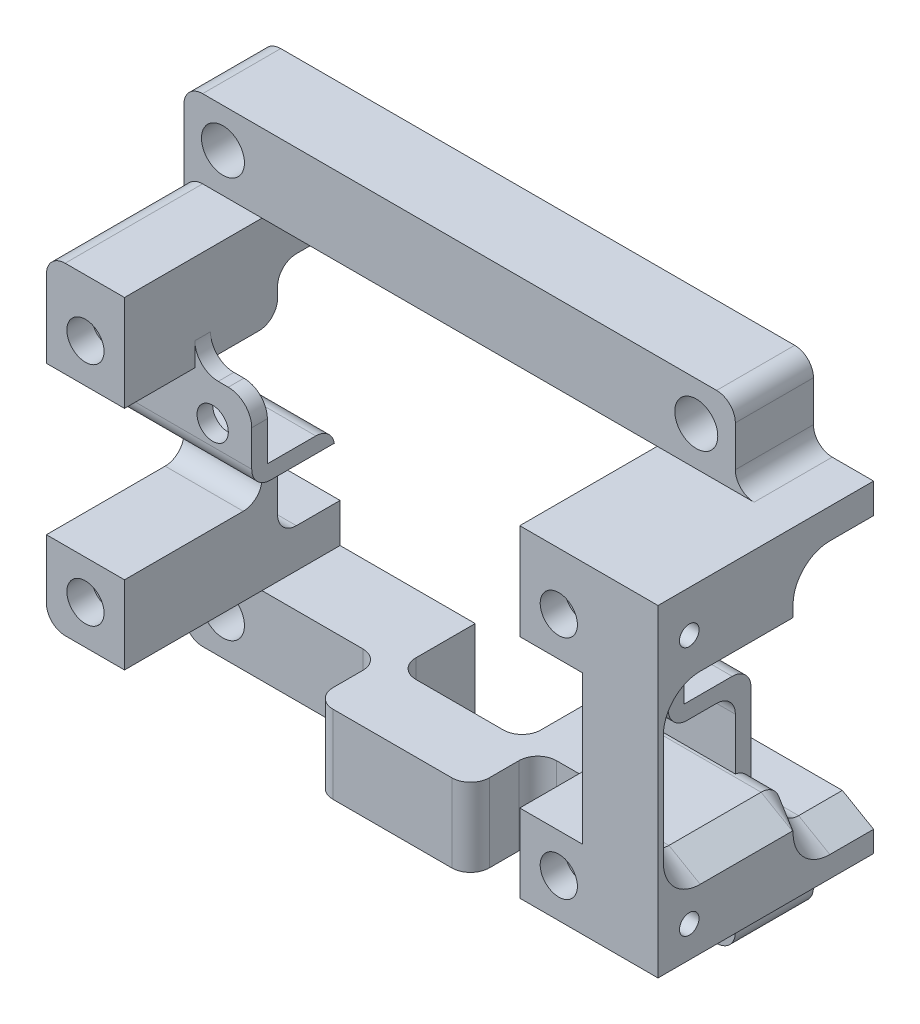
from build123d import *
from OCP.BRepFilletAPI import BRepFilletAPI_MakeChamfer

# Parameters (mm, degrees)
SKETCH1_W                       = 70.6
SKETCH1_H                       = 61.3
BOSS_EXTRUDE1_DEPTH             = 10
SKETCH2_W                       = 17.2875
SKETCH2_H                       = 10
BOSS_EXTRUDE2_DEPTH             = 8.6
M3_CLEARANCE_HOLE1_D            = 4
M3_CLEARANCE_HOLE1_DEPTH        = 10
M3_CLEARANCE_HOLE1_TIP          = 1.201721238
M5_CLEARANCE_HOLE1_D            = 5.5
M5_CLEARANCE_HOLE1_DEPTH        = 10
M5_CLEARANCE_HOLE1_TIP          = 1.652366702
SKETCH11_W                      = 20
SKETCH11_H                      = 10
BOSS_EXTRUDE3_DEPTH             = 8.6
CUT_EXTRUDE1_REACH              = 92.24
SKETCH15_W                      = 16
SKETCH15_H                      = 10
SKETCH16_W                      = 10
SKETCH16_H                      = 10
SKETCH16_H_2                    = 12.3
BOSS_EXTRUDE4_DEPTH             = 17.6
SKETCH17_R                      = 2.38125
CUT_EXTRUDE2_DEPTH              = 3.175
SKETCH18_W                      = 27.6
SKETCH18_H                      = 10
SKETCH18_H_2                    = 12.3
BOSS_EXTRUDE5_DEPTH             = 7.7
SKETCH19_W                      = 8.6
SKETCH19_H                      = 8
CUT_EXTRUDE3_DEPTH              = 98.524011489
SKETCH20_W                      = 9.675069895
SKETCH20_H                      = 19
BOSS_EXTRUDE6_DEPTH             = 3
FILLET4_START                   = -63.558014619
FILLET4_DEPTH                   = 10
FILLET4_START_2                 = 5.066915486
FILLET4_2_DEPTH                 = 9.675069895
FILLET4_START_3                 = -2.958014619
FILLET4_3_DEPTH                 = 10
FILLET4_START_4                 = -10.130841154
FILLET4_4_DEPTH                 = 10
FILLET4_5_DEPTH                 = 79.558014619
FILLET4_START_5                 = 7.041985381
FILLET4_6_DEPTH                 = 8.958014619
FILLET4_START_6                 = -7.815230369
FILLET4_7_DEPTH                 = 14.85721575
FILLET4_START_7                 = -11
FILLET4_8_DEPTH                 = 10.869158846
FILLET5_R                       = 2.4
TAP_DRILL_FOR_M3X0_5_TAP1_D     = 2.5
TAP_DRILL_FOR_M3X0_5_TAP1_DEPTH = 8
TAP_DRILL_FOR_M3X0_5_TAP1_TIP   = 0.751075774
CHAMFER1_SIZE                   = 4
CHAMFER1_SIZE2                  = 2.309401077
FILLET7_R                       = 3


with BuildPart() as part:
    # Sketch1 → Boss-Extrude1 (new body)
    with BuildSketch(Plane.XY):
        with Locations((-28.258014619, 20.519158846)):
            Rectangle(SKETCH1_W, SKETCH1_H)
        Polygon((-2.958014619, -0.130841154), (-53.558014619, -0.130841154), (-53.558014619, 18.869158846), (-46.270514619, 18.869158846), (-46.270514619, 28.869158846), (-53.558014619, 28.869158846), (-53.558014619, 41.169158846), (-2.958014619, 41.169158846), (-2.958014619, 28.869158846), (-10.245514619, 28.869158846), (-10.245514619, 18.869158846), (-2.958014619, 18.869158846), align=None, mode=Mode.SUBTRACT)
    extrude(amount=BOSS_EXTRUDE1_DEPTH)

    # Sketch2 → Boss-Extrude2 (add)
    with BuildSketch(Plane.XY.offset(10)):
        with Locations((-54.914264619, 23.869158846)):
            Rectangle(SKETCH2_W, SKETCH2_H)
        with Locations((-1.601764619, 23.869158846)):
            Rectangle(SKETCH2_W, SKETCH2_H)
    extrude(amount=BOSS_EXTRUDE2_DEPTH)

    # M3 Clearance Hole1
    with Locations(Plane.XY.offset(18.6)):
        with Locations((-51.270514619, 23.869158846), (-5.245514619, 23.869158846)):
            Hole(M3_CLEARANCE_HOLE1_D / 2, depth=M3_CLEARANCE_HOLE1_DEPTH)
            with Locations((0, 0, -(M3_CLEARANCE_HOLE1_DEPTH + M3_CLEARANCE_HOLE1_TIP / 2))):  # 118° drill point
                Cone(0, M3_CLEARANCE_HOLE1_D / 2, M3_CLEARANCE_HOLE1_TIP, mode=Mode.SUBTRACT)

    # M5 Clearance Hole1
    with Locations(Plane.XY.offset(10)):
        with Locations((-58.558014619, -5.130841154), (2.041985381, -5.130841154), (-58.558014619, 46.169158846), (2.041985381, 46.169158846)):
            Hole(M5_CLEARANCE_HOLE1_D / 2, depth=M5_CLEARANCE_HOLE1_DEPTH)
            with Locations((0, 0, -(M5_CLEARANCE_HOLE1_DEPTH + M5_CLEARANCE_HOLE1_TIP / 2))):  # 118° drill point
                Cone(0, M5_CLEARANCE_HOLE1_D / 2, M5_CLEARANCE_HOLE1_TIP, mode=Mode.SUBTRACT)

    # Sketch11 → Boss-Extrude3 (add)
    with BuildSketch(Plane.XY.offset(10)):
        with Locations((-28.258014619, -5.130841154)):
            Rectangle(SKETCH11_W, SKETCH11_H)
    extrude(amount=BOSS_EXTRUDE3_DEPTH)

    # Sketch15 → Cut-Extrude1 (cut, up to next)
    with BuildSketch(Plane.XZ.offset(10.130841154), mode=Mode.PRIVATE) as cut_extrude1_sk1:
        with Locations((-28.258014619, 5)):
            Rectangle(SKETCH15_W, SKETCH15_H)
    cut_extrude1_tool1 = extrude(cut_extrude1_sk1.sketch, amount=-CUT_EXTRUDE1_REACH, mode=Mode.PRIVATE) & part.part
    add(cut_extrude1_tool1.solids().sort_by_distance((-28.258015, -10.130841, 5))[0], mode=Mode.SUBTRACT)

    # Sketch16 → Boss-Extrude4 (add)
    with BuildSketch(Plane.XY.offset(10)):
        with Locations((2.041985381, 4.869158846)):
            Rectangle(SKETCH16_W, SKETCH16_H)
        with Locations((2.041985381, 35.019158846)):
            Rectangle(SKETCH16_W, SKETCH16_H_2)
        with Locations((-58.558014619, 35.019158846)):
            Rectangle(SKETCH16_W, SKETCH16_H_2)
        with Locations((-58.558014619, 4.869158846)):
            Rectangle(SKETCH16_W, SKETCH16_H)
    extrude(amount=BOSS_EXTRUDE4_DEPTH)

    # Sketch17 → Cut-Extrude2 (cut)
    with BuildSketch(Plane.XY.offset(27.6)):
        with Locations((-58.558014619, 4.869158846)):
            Circle(SKETCH17_R)
        with Locations((2.041985381, 33.869158846)):
            Circle(SKETCH17_R)
        with Locations((2.041985381, 4.869158846)):
            Circle(SKETCH17_R)
        with Locations((-58.558014619, 33.869158846)):
            Circle(SKETCH17_R)
    extrude(amount=-CUT_EXTRUDE2_DEPTH, mode=Mode.SUBTRACT)

    # Sketch18 → Boss-Extrude5 (add)
    with BuildSketch(Plane(origin=(7.041985381, 0, 0), x_dir=(0, 0, -1), z_dir=(1, 0, 0))):
        with Locations((-13.8, 4.869158846)):
            Rectangle(SKETCH18_W, SKETCH18_H)
        with Locations((-13.8, 35.019158846)):
            Rectangle(SKETCH18_W, SKETCH18_H_2)
    extrude(amount=BOSS_EXTRUDE5_DEPTH)

    # Sketch19 → Cut-Extrude3 (cut, through all)
    with BuildSketch(Plane(origin=(14.741985381, 0, 0), x_dir=(0, 0, -1), z_dir=(1, 0, 0))):
        Polygon((-8, 4.869158846), (0, 4.869158846), (0, 28.869158846), (-8, 28.869158846), (-8, 20.869158846), align=None)
        Polygon((-8, 28.869158846), (0, 28.869158846), (0, 35.019158846), (-8, 35.019158846), (-8, 30.971185105), align=None)
        with Locations((-12.3, 24.869158846)):
            Rectangle(SKETCH19_W, SKETCH19_H)
    extrude(amount=-CUT_EXTRUDE3_DEPTH, mode=Mode.SUBTRACT)


with BuildPart() as body_2:
    # Sketch20 → Boss-Extrude6 (new body)
    with BuildSketch(Plane.XY.offset(27.6)):
        with Locations((9.904450434, 19.369158846)):
            Rectangle(SKETCH20_W, SKETCH20_H)
    extrude(amount=-BOSS_EXTRUDE6_DEPTH)

    # Combine1: union part
    add(part.part)

    # Fillet4: read off the stored shape, not the designer's step
    # Fillet4 outline → Fillet4 (add)
    with BuildSketch(Plane.YZ.offset(FILLET4_START)):
        with BuildLine():
            Line((9.869158846, 10), (12.269158846, 10))
            ThreePointArc((12.269158846, 10), (10.572102571, 10.702943725), (9.869158846, 12.4))
            Line((9.869158846, 12.4), (9.869158846, 10))
        make_face()
        with BuildLine():
            Line((35.019158846, 8), (32.619158846, 8))
            ThreePointArc((32.619158846, 8), (34.316215121, 7.297056275), (35.019158846, 5.6))
            Line((35.019158846, 5.6), (35.019158846, 8))
        make_face()
        with BuildLine():
            ThreePointArc((4.869158846, 5.6), (5.572102571, 7.297056275), (7.269158846, 8))
            Line((7.269158846, 8), (4.869158846, 8))
            Line((4.869158846, 8), (4.869158846, 5.6))
        make_face()
        with BuildLine():
            ThreePointArc((18.869158846, 12.4), (18.16621512, 10.702943726), (16.469158846, 10))
            Line((16.469158846, 10), (18.869158846, 10))
            Line((18.869158846, 10), (18.869158846, 12.4))
        make_face()
    extrude(amount=FILLET4_DEPTH)

    # Fillet4 2 outline → Fillet4 2 (add)
    with BuildSketch(Plane.YZ.offset(FILLET4_START_2)):
        with BuildLine():
            Line((35.019158846, 8), (32.619158846, 8))
            ThreePointArc((32.619158846, 8), (34.316215121, 7.297056275), (35.019158846, 5.6))
            Line((35.019158846, 5.6), (35.019158846, 8))
        make_face()
        with BuildLine():
            ThreePointArc((4.869158846, 5.6), (5.572102571, 7.297056275), (7.269158846, 8))
            Line((7.269158846, 8), (4.869158846, 8))
            Line((4.869158846, 8), (4.869158846, 5.6))
        make_face()
        with BuildLine():
            Line((9.869158846, 24.6), (9.869158846, 22.2))
            ThreePointArc((9.869158846, 22.2), (10.572102571, 23.897056275), (12.269158846, 24.6))
            Line((12.269158846, 24.6), (9.869158846, 24.6))
        make_face()
        with BuildLine():
            Line((28.869158846, 24.6), (26.469158846, 24.6))
            ThreePointArc((26.469158846, 24.6), (28.166215121, 23.897056275), (28.869158846, 22.2))
            Line((28.869158846, 22.2), (28.869158846, 24.6))
        make_face()
    extrude(amount=FILLET4_2_DEPTH)

    # Fillet4 3 outline → Fillet4 3 (add)
    with BuildSketch(Plane.YZ.offset(FILLET4_START_3)):
        with BuildLine():
            Line((35.019158846, 8), (32.619158846, 8))
            ThreePointArc((32.619158846, 8), (34.316215121, 7.297056275), (35.019158846, 5.6))
            Line((35.019158846, 5.6), (35.019158846, 8))
        make_face()
        with BuildLine():
            ThreePointArc((4.869158846, 5.6), (5.572102571, 7.297056275), (7.269158846, 8))
            Line((7.269158846, 8), (4.869158846, 8))
            Line((4.869158846, 8), (4.869158846, 5.6))
        make_face()
        with BuildLine():
            ThreePointArc((18.869158846, 12.4), (18.16621512, 10.702943726), (16.469158846, 10))
            Line((16.469158846, 10), (18.869158846, 10))
            Line((18.869158846, 10), (18.869158846, 12.4))
        make_face()
    extrude(amount=FILLET4_3_DEPTH)

    # Fillet4 4 outline → Fillet4 4 (add)
    with BuildSketch(Plane(origin=(0, 0, 0), x_dir=(1, 0, 0), z_dir=(0, 1, 0)).offset(FILLET4_START_4)):
        with BuildLine():
            Line((-36.258014619, -10), (-33.858014619, -10))
            ThreePointArc((-33.858014619, -10), (-35.555070894, -9.297056275), (-36.258014619, -7.6))
            Line((-36.258014619, -7.6), (-36.258014619, -10))
        make_face()
        with BuildLine():
            ThreePointArc((-20.258014619, -7.6), (-20.960958344, -9.297056275), (-22.658014619, -10))
            Line((-22.658014619, -10), (-20.258014619, -10))
            Line((-20.258014619, -10), (-20.258014619, -7.6))
        make_face()
        with BuildLine():
            ThreePointArc((-40.658014619, -10), (-38.960958344, -10.702943725), (-38.258014619, -12.4))
            Line((-38.258014619, -12.4), (-38.258014619, -10))
            Line((-38.258014619, -10), (-40.658014619, -10))
        make_face()
        with BuildLine():
            ThreePointArc((-18.258014619, -12.4), (-17.555070894, -10.702943725), (-15.858014619, -10))
            Line((-15.858014619, -10), (-18.258014619, -10))
            Line((-18.258014619, -10), (-18.258014619, -12.4))
        make_face()
    extrude(amount=FILLET4_4_DEPTH)

    # Fillet4 5 outline → Fillet4 5 (cut)
    with BuildSketch(Plane.YZ.offset(FILLET4_START)):
        with BuildLine():
            ThreePointArc((31.269158846, 8), (29.572102571, 8.702943725), (28.869158846, 10.4))
            Line((28.869158846, 10.4), (28.869158846, 8))
            Line((28.869158846, 8), (31.269158846, 8))
        make_face()
        with BuildLine():
            Line((18.869158846, 18.6), (18.869158846, 16.2))
            ThreePointArc((18.869158846, 16.2), (19.572102571, 17.897056275), (21.269158846, 18.6))
            Line((21.269158846, 18.6), (18.869158846, 18.6))
        make_face()
        with BuildLine():
            Line((18.469158846, 8), (20.869158846, 8))
            Line((20.869158846, 8), (20.869158846, 10.4))
            ThreePointArc((20.869158846, 10.4), (20.16621512, 8.702943726), (18.469158846, 8))
        make_face()
    extrude(amount=FILLET4_5_DEPTH, mode=Mode.SUBTRACT)

    # Fillet4 6 outline → Fillet4 6 (cut)
    with BuildSketch(Plane.YZ.offset(FILLET4_START_5)):
        with BuildLine():
            ThreePointArc((9.869158846, 10.4), (9.16621512, 8.702943726), (7.469158846, 8))
            Line((7.469158846, 8), (9.869158846, 8))
            Line((9.869158846, 8), (9.869158846, 10.4))
        make_face()
    extrude(amount=FILLET4_6_DEPTH, mode=Mode.SUBTRACT)

    # Fillet4 7 outline → Fillet4 7 (cut)
    with BuildSketch(Plane.YZ.offset(FILLET4_START_6)):
        with BuildLine():
            Line((9.835590759, 10), (9.869158846, 10))
            Line((9.869158846, 10), (9.869158846, 10.4))
            ThreePointArc((9.869158846, 10.4), (9.860752101, 10.199296975), (9.835590759, 10))
        make_face()
    extrude(amount=FILLET4_7_DEPTH, mode=Mode.SUBTRACT)

    # Fillet4 8 outline → Fillet4 8 (cut)
    with BuildSketch(Plane(origin=(0, 0, 0), x_dir=(1, 0, 0), z_dir=(0, 1, 0)).offset(FILLET4_START_7)):
        with BuildLine():
            Line((-38.258014619, -18.6), (-35.858014619, -18.6))
            ThreePointArc((-35.858014619, -18.6), (-37.555070894, -17.897056275), (-38.258014619, -16.2))
            Line((-38.258014619, -16.2), (-38.258014619, -18.6))
        make_face()
        with BuildLine():
            Line((-18.258014619, -18.6), (-18.258014619, -16.2))
            ThreePointArc((-18.258014619, -16.2), (-18.960958344, -17.897056275), (-20.658014619, -18.6))
            Line((-20.658014619, -18.6), (-18.258014619, -18.6))
        make_face()
    extrude(amount=FILLET4_8_DEPTH, mode=Mode.SUBTRACT)

    # Fillet5
    fillet5_edges = [body_2.edges().sort_by_distance(p)[0] for p in [
        (-63.558014619, 41.169158846, 18.8),
        (-63.558014619, 51.169158846, 5),
        (-63.558014619, -10.130841154, 5),
        (7.041985381, -10.130841154, 5),
        (7.041985381, 51.169158846, 5),
        (7.041985381, -0.130841154, 5),
        (7.041985381, 41.169158846, 5),
        (-63.558014619, -0.130841154, 18.8),
    ]]
    fillet(fillet5_edges, radius=FILLET5_R)

    # Tap Drill for M3x0.5 Tap1
    with Locations(Plane(origin=(14.741985381, 0, 0), x_dir=(0, 0, -1), z_dir=(1, 0, 0))):
        with Locations((-23.6, 3.869158846), (-23.6, 35.869158846)):
            Hole(TAP_DRILL_FOR_M3X0_5_TAP1_D / 2, depth=TAP_DRILL_FOR_M3X0_5_TAP1_DEPTH)
            with Locations((0, 0, -(TAP_DRILL_FOR_M3X0_5_TAP1_DEPTH + TAP_DRILL_FOR_M3X0_5_TAP1_TIP / 2))):  # 118° drill point
                Cone(0, TAP_DRILL_FOR_M3X0_5_TAP1_D / 2, TAP_DRILL_FOR_M3X0_5_TAP1_TIP, mode=Mode.SUBTRACT)

    # Chamfer1: one chamfer whose edges measure the first distance from different faces: ONE call of the kernel's chamfer builder (chamfer() names one face for all edges)
    chamfer1_edges_1 = [body_2.edges().sort_by_distance(p)[0] for p in [
        (14.741985381, 7.369158846, 8),
    ]]
    chamfer1_side_1 = [body_2.faces().sort_by_distance(p)[0] for p in [
        (2.162022373, 12.794559586, 8),
    ]]
    chamfer1_edges_2 = [body_2.edges().sort_by_distance(p)[0] for p in [
        (14.741985381, 31.944158846, 8),
    ]]
    chamfer1_side_2 = [body_2.faces().sort_by_distance(p)[0] for p in [
        (5.891985381, 31.944158846, 8),
    ]]
    chamfer1_edges_3 = [body_2.edges().sort_by_distance(p)[0] for p in [
        (14.741985381, 28.869158846, 16.3),
    ]]
    chamfer1_side_3 = [body_2.faces().sort_by_distance(p)[0] for p in [
        (2.041985381, 28.869158846, 18.846805592),
    ]]
    chamfer1_edges_4 = [body_2.edges().sort_by_distance(p)[0] for p in [
        (14.741985381, 9.869158846, 16.3),
    ]]
    chamfer1_side_4 = [body_2.faces().sort_by_distance(p)[0] for p in [
        (5.060751356, 9.869158846, 17.777738702),
    ]]
    chamfer1_edges_5 = [body_2.edges().sort_by_distance(p)[0] for p in [
        (14.741985381, 19.369158846, 24.6),
    ]]
    chamfer1_side_5 = [body_2.faces().sort_by_distance(p)[0] for p in [
        (9.904450433, 19.369158846, 24.6),
    ]]
    chamfer1_edges_6 = [body_2.edges().sort_by_distance(p)[0] for p in [
        (14.741985381, 9.16621512, 8.702943726),
    ]]
    chamfer1_side_6 = [body_2.faces().sort_by_distance(p)[0] for p in [
        (10.891985381, 9.16621512, 8.702943726),
    ]]
    chamfer1_edges_7 = [body_2.edges().sort_by_distance(p)[0] for p in [
        (14.741985381, 29.572102571, 8.702943725),
    ]]
    chamfer1_side_7 = [body_2.faces().sort_by_distance(p)[0] for p in [
        (5.891985381, 29.572102571, 8.702943725),
    ]]
    chamfer1_edges_8 = [body_2.edges().sort_by_distance(p)[0] for p in [
        (14.741985381, 5.572102571, 7.297056275),
    ]]
    chamfer1_side_8 = [body_2.faces().sort_by_distance(p)[0] for p in [
        (5.891985381, 5.572102571, 7.297056275),
    ]]
    chamfer1_edges_9 = [body_2.edges().sort_by_distance(p)[0] for p in [
        (14.741985381, 34.316215121, 7.297056275),
    ]]
    chamfer1_side_9 = [body_2.faces().sort_by_distance(p)[0] for p in [
        (5.891985381, 34.316215121, 7.297056275),
    ]]
    chamfer1_edges_10 = [body_2.edges().sort_by_distance(p)[0] for p in [
        (14.741985381, 28.166215121, 23.897056275),
    ]]
    chamfer1_side_10 = [body_2.faces().sort_by_distance(p)[0] for p in [
        (9.904450433, 28.166215121, 23.897056275),
    ]]
    chamfer1_edges_11 = [body_2.edges().sort_by_distance(p)[0] for p in [
        (14.741985381, 4.869158846, 2.8),
    ]]
    chamfer1_side_11 = [body_2.faces().sort_by_distance(p)[0] for p in [
        (5.891985381, 4.869158846, 2.8),
    ]]
    chamfer1_edges_12 = [body_2.edges().sort_by_distance(p)[0] for p in [
        (14.741985381, 10.572102571, 23.897056275),
    ]]
    chamfer1_side_12 = [body_2.faces().sort_by_distance(p)[0] for p in [
        (9.904450433, 10.572102571, 23.897056275),
    ]]
    chamfer1_edges_13 = [body_2.edges().sort_by_distance(p)[0] for p in [
        (14.741985381, 35.019158846, 2.8),
    ]]
    chamfer1_side_13 = [body_2.faces().sort_by_distance(p)[0] for p in [
        (5.891985381, 35.019158846, 2.8),
    ]]
    chamfer1 = BRepFilletAPI_MakeChamfer(body_2.part.solid().wrapped)
    for e in chamfer1_edges_1:
        chamfer1.Add(CHAMFER1_SIZE, CHAMFER1_SIZE2, e.wrapped, chamfer1_side_1[0].wrapped)  # the first distance lies on this face
    for e in chamfer1_edges_2:
        chamfer1.Add(CHAMFER1_SIZE, CHAMFER1_SIZE2, e.wrapped, chamfer1_side_2[0].wrapped)  # the first distance lies on this face
    for e in chamfer1_edges_3:
        chamfer1.Add(CHAMFER1_SIZE, CHAMFER1_SIZE2, e.wrapped, chamfer1_side_3[0].wrapped)  # the first distance lies on this face
    for e in chamfer1_edges_4:
        chamfer1.Add(CHAMFER1_SIZE, CHAMFER1_SIZE2, e.wrapped, chamfer1_side_4[0].wrapped)  # the first distance lies on this face
    for e in chamfer1_edges_5:
        chamfer1.Add(CHAMFER1_SIZE, CHAMFER1_SIZE2, e.wrapped, chamfer1_side_5[0].wrapped)  # the first distance lies on this face
    for e in chamfer1_edges_6:
        chamfer1.Add(CHAMFER1_SIZE, CHAMFER1_SIZE2, e.wrapped, chamfer1_side_6[0].wrapped)  # the first distance lies on this face
    for e in chamfer1_edges_7:
        chamfer1.Add(CHAMFER1_SIZE, CHAMFER1_SIZE2, e.wrapped, chamfer1_side_7[0].wrapped)  # the first distance lies on this face
    for e in chamfer1_edges_8:
        chamfer1.Add(CHAMFER1_SIZE, CHAMFER1_SIZE2, e.wrapped, chamfer1_side_8[0].wrapped)  # the first distance lies on this face
    for e in chamfer1_edges_9:
        chamfer1.Add(CHAMFER1_SIZE, CHAMFER1_SIZE2, e.wrapped, chamfer1_side_9[0].wrapped)  # the first distance lies on this face
    for e in chamfer1_edges_10:
        chamfer1.Add(CHAMFER1_SIZE, CHAMFER1_SIZE2, e.wrapped, chamfer1_side_10[0].wrapped)  # the first distance lies on this face
    for e in chamfer1_edges_11:
        chamfer1.Add(CHAMFER1_SIZE, CHAMFER1_SIZE2, e.wrapped, chamfer1_side_11[0].wrapped)  # the first distance lies on this face
    for e in chamfer1_edges_12:
        chamfer1.Add(CHAMFER1_SIZE, CHAMFER1_SIZE2, e.wrapped, chamfer1_side_12[0].wrapped)  # the first distance lies on this face
    for e in chamfer1_edges_13:
        chamfer1.Add(CHAMFER1_SIZE, CHAMFER1_SIZE2, e.wrapped, chamfer1_side_13[0].wrapped)  # the first distance lies on this face
    add(Compound.cast(chamfer1.Shape()), mode=Mode.REPLACE)

    # Fillet7
    fillet7_edges = [body_2.edges().sort_by_distance(p)[0] for p in [
        (-46.270514619, 28.869158846, 17.6),
        (-10.245514619, 28.869158846, 17.6),
        (-53.558014619, 28.869158846, 17.6),
        (-2.958014619, 28.869158846, 17.6),
    ]]
    fillet(fillet7_edges, radius=FILLET7_R)


solid = body_2.part
